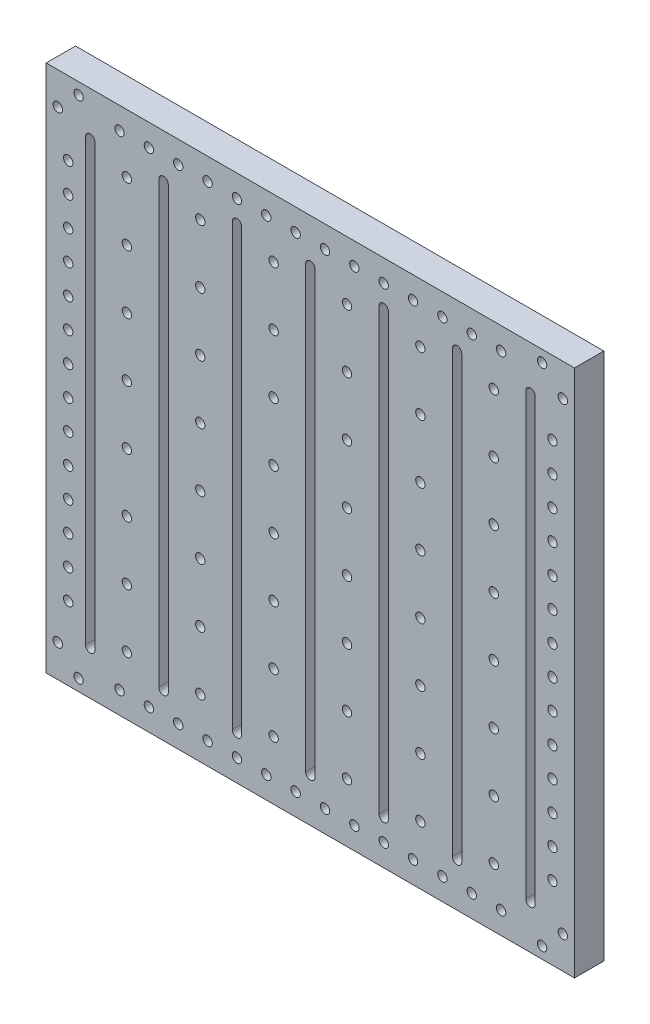
from build123d import *

# Parameters (mm, degrees)
SKETCH1_W             = 180
SKETCH1_H             = 180
SKETCH1_R             = 1.6
BOSS_EXTRUDE1_DEPTH   = 10
CRVPATTERN1_OUTLINE_R = 1.6
CRVPATTERN1_DEPTH     = 10


# Read off the part's stored shape, not the designer's step: CrvPattern1
with BuildPart() as part:
    # Sketch1 → Boss-Extrude1 (new body)
    with BuildSketch(Plane.XY):
        Rectangle(SKETCH1_W, SKETCH1_H)
        with Locations((-78.964466094, 86.035533906)):
            Circle(SKETCH1_R, mode=Mode.SUBTRACT)
        with Locations((-86.035533906, 78.964466094)):
            Circle(SKETCH1_R, mode=Mode.SUBTRACT)
        with Locations((78.964466094, 86.035533906)):
            Circle(SKETCH1_R, mode=Mode.SUBTRACT)
        with Locations((86.035533906, 78.964466094)):
            Circle(SKETCH1_R, mode=Mode.SUBTRACT)
        with Locations((86.035533906, -78.964466094)):
            Circle(SKETCH1_R, mode=Mode.SUBTRACT)
        with Locations((78.964466094, -86.035533906)):
            Circle(SKETCH1_R, mode=Mode.SUBTRACT)
        with Locations((-78.964466094, -86.035533906)):
            Circle(SKETCH1_R, mode=Mode.SUBTRACT)
        with Locations((-86.035533906, -78.964466094)):
            Circle(SKETCH1_R, mode=Mode.SUBTRACT)
        with Locations((-5, 82.5)):
            Circle(SKETCH1_R, mode=Mode.SUBTRACT)
        with Locations((5, 82.5)):
            Circle(SKETCH1_R, mode=Mode.SUBTRACT)
        with Locations((-15, 82.5)):
            Circle(SKETCH1_R, mode=Mode.SUBTRACT)
        with Locations((-25, 82.5)):
            Circle(SKETCH1_R, mode=Mode.SUBTRACT)
        with Locations((-35, 82.5)):
            Circle(SKETCH1_R, mode=Mode.SUBTRACT)
        with Locations((-45, 82.5)):
            Circle(SKETCH1_R, mode=Mode.SUBTRACT)
        with Locations((-55, 82.5)):
            Circle(SKETCH1_R, mode=Mode.SUBTRACT)
        with Locations((-65, 82.5)):
            Circle(SKETCH1_R, mode=Mode.SUBTRACT)
        with Locations((15, 82.5)):
            Circle(SKETCH1_R, mode=Mode.SUBTRACT)
        with Locations((25, 82.5)):
            Circle(SKETCH1_R, mode=Mode.SUBTRACT)
        with Locations((35, 82.5)):
            Circle(SKETCH1_R, mode=Mode.SUBTRACT)
        with Locations((45, 82.5)):
            Circle(SKETCH1_R, mode=Mode.SUBTRACT)
        with Locations((55, 82.5)):
            Circle(SKETCH1_R, mode=Mode.SUBTRACT)
        with Locations((65, 82.5)):
            Circle(SKETCH1_R, mode=Mode.SUBTRACT)
        with Locations((82.5, 65)):
            Circle(SKETCH1_R, mode=Mode.SUBTRACT)
        with Locations((82.5, 55)):
            Circle(SKETCH1_R, mode=Mode.SUBTRACT)
        with Locations((82.5, 45)):
            Circle(SKETCH1_R, mode=Mode.SUBTRACT)
        with Locations((82.5, 35)):
            Circle(SKETCH1_R, mode=Mode.SUBTRACT)
        with Locations((82.5, 25)):
            Circle(SKETCH1_R, mode=Mode.SUBTRACT)
        with Locations((82.5, 15)):
            Circle(SKETCH1_R, mode=Mode.SUBTRACT)
        with Locations((82.5, 5)):
            Circle(SKETCH1_R, mode=Mode.SUBTRACT)
        with Locations((82.5, -5)):
            Circle(SKETCH1_R, mode=Mode.SUBTRACT)
        with Locations((82.5, -15)):
            Circle(SKETCH1_R, mode=Mode.SUBTRACT)
        with Locations((82.5, -25)):
            Circle(SKETCH1_R, mode=Mode.SUBTRACT)
        with Locations((82.5, -35)):
            Circle(SKETCH1_R, mode=Mode.SUBTRACT)
        with Locations((82.5, -45)):
            Circle(SKETCH1_R, mode=Mode.SUBTRACT)
        with Locations((82.5, -55)):
            Circle(SKETCH1_R, mode=Mode.SUBTRACT)
        with Locations((82.5, -65)):
            Circle(SKETCH1_R, mode=Mode.SUBTRACT)
        with Locations((65, -82.5)):
            Circle(SKETCH1_R, mode=Mode.SUBTRACT)
        with Locations((55, -82.5)):
            Circle(SKETCH1_R, mode=Mode.SUBTRACT)
        with Locations((45, -82.5)):
            Circle(SKETCH1_R, mode=Mode.SUBTRACT)
        with Locations((35, -82.5)):
            Circle(SKETCH1_R, mode=Mode.SUBTRACT)
        with Locations((25, -82.5)):
            Circle(SKETCH1_R, mode=Mode.SUBTRACT)
        with Locations((15, -82.5)):
            Circle(SKETCH1_R, mode=Mode.SUBTRACT)
        with Locations((5, -82.5)):
            Circle(SKETCH1_R, mode=Mode.SUBTRACT)
        with Locations((-5, -82.5)):
            Circle(SKETCH1_R, mode=Mode.SUBTRACT)
        with Locations((-15, -82.5)):
            Circle(SKETCH1_R, mode=Mode.SUBTRACT)
        with Locations((-25, -82.5)):
            Circle(SKETCH1_R, mode=Mode.SUBTRACT)
        with Locations((-35, -82.5)):
            Circle(SKETCH1_R, mode=Mode.SUBTRACT)
        with Locations((-45, -82.5)):
            Circle(SKETCH1_R, mode=Mode.SUBTRACT)
        with Locations((-55, -82.5)):
            Circle(SKETCH1_R, mode=Mode.SUBTRACT)
        with Locations((-65, -82.5)):
            Circle(SKETCH1_R, mode=Mode.SUBTRACT)
        with Locations((-82.5, -65)):
            Circle(SKETCH1_R, mode=Mode.SUBTRACT)
        with Locations((-82.5, -55)):
            Circle(SKETCH1_R, mode=Mode.SUBTRACT)
        with Locations((-82.5, -45)):
            Circle(SKETCH1_R, mode=Mode.SUBTRACT)
        with Locations((-82.5, -35)):
            Circle(SKETCH1_R, mode=Mode.SUBTRACT)
        with Locations((-82.5, -25)):
            Circle(SKETCH1_R, mode=Mode.SUBTRACT)
        with Locations((-82.5, -15)):
            Circle(SKETCH1_R, mode=Mode.SUBTRACT)
        with Locations((-82.5, -5)):
            Circle(SKETCH1_R, mode=Mode.SUBTRACT)
        with Locations((-82.5, 5)):
            Circle(SKETCH1_R, mode=Mode.SUBTRACT)
        with Locations((-82.5, 15)):
            Circle(SKETCH1_R, mode=Mode.SUBTRACT)
        with Locations((-82.5, 25)):
            Circle(SKETCH1_R, mode=Mode.SUBTRACT)
        with Locations((-82.5, 35)):
            Circle(SKETCH1_R, mode=Mode.SUBTRACT)
        with Locations((-82.5, 45)):
            Circle(SKETCH1_R, mode=Mode.SUBTRACT)
        with Locations((-82.5, 55)):
            Circle(SKETCH1_R, mode=Mode.SUBTRACT)
        with Locations((-82.5, 65)):
            Circle(SKETCH1_R, mode=Mode.SUBTRACT)
        with Locations((-62.5, 70)):
            Circle(SKETCH1_R, mode=Mode.SUBTRACT)
        with Locations((-37.5, 70)):
            Circle(SKETCH1_R, mode=Mode.SUBTRACT)
        with Locations((-12.5, 70)):
            Circle(SKETCH1_R, mode=Mode.SUBTRACT)
        with Locations((12.5, 70)):
            Circle(SKETCH1_R, mode=Mode.SUBTRACT)
        with Locations((37.5, 70)):
            Circle(SKETCH1_R, mode=Mode.SUBTRACT)
        with Locations((62.5, 70)):
            Circle(SKETCH1_R, mode=Mode.SUBTRACT)
        with BuildLine():
            Line((-1.6, 75), (-1.6, -75))
            ThreePointArc((-1.6, -75), (0, -76.6), (1.6, -75))
            Line((1.6, -75), (1.6, 75))
            ThreePointArc((1.6, 75), (0, 76.6), (-1.6, 75))
        make_face(mode=Mode.SUBTRACT)
        with BuildLine():
            Line((23.4, 75), (23.4, -75))
            ThreePointArc((23.4, -75), (25, -76.6), (26.6, -75))
            Line((26.6, -75), (26.6, 75))
            ThreePointArc((26.6, 75), (25, 76.6), (23.4, 75))
        make_face(mode=Mode.SUBTRACT)
        with BuildLine():
            Line((48.4, 75), (48.4, -75))
            ThreePointArc((48.4, -75), (50, -76.6), (51.6, -75))
            Line((51.6, -75), (51.6, 75))
            ThreePointArc((51.6, 75), (50, 76.6), (48.4, 75))
        make_face(mode=Mode.SUBTRACT)
        with BuildLine():
            Line((73.4, 75), (73.4, -75))
            ThreePointArc((73.4, -75), (75, -76.6), (76.6, -75))
            Line((76.6, -75), (76.6, 75))
            ThreePointArc((76.6, 75), (75, 76.6), (73.4, 75))
        make_face(mode=Mode.SUBTRACT)
        with BuildLine():
            Line((-26.6, 75), (-26.6, -75))
            ThreePointArc((-26.6, -75), (-25, -76.6), (-23.4, -75))
            Line((-23.4, -75), (-23.4, 75))
            ThreePointArc((-23.4, 75), (-25, 76.6), (-26.6, 75))
        make_face(mode=Mode.SUBTRACT)
        with BuildLine():
            Line((-51.6, 75), (-51.6, -75))
            ThreePointArc((-51.6, -75), (-50, -76.6), (-48.4, -75))
            Line((-48.4, -75), (-48.4, 75))
            ThreePointArc((-48.4, 75), (-50, 76.6), (-51.6, 75))
        make_face(mode=Mode.SUBTRACT)
        with BuildLine():
            Line((-76.6, 75), (-76.6, -75))
            ThreePointArc((-76.6, -75), (-75, -76.6), (-73.4, -75))
            Line((-73.4, -75), (-73.4, 75))
            ThreePointArc((-73.4, 75), (-75, 76.6), (-76.6, 75))
        make_face(mode=Mode.SUBTRACT)
    extrude(amount=BOSS_EXTRUDE1_DEPTH)

    # CrvPattern1 outline → CrvPattern1 (cut)
    with BuildSketch(Plane.XY):
        with Locations((62.5, -70)):
            Circle(CRVPATTERN1_OUTLINE_R)
        with Locations((37.5, -70)):
            Circle(CRVPATTERN1_OUTLINE_R)
        with Locations((12.5, -70)):
            Circle(CRVPATTERN1_OUTLINE_R)
        with Locations((-12.5, -70)):
            Circle(CRVPATTERN1_OUTLINE_R)
        with Locations((-37.5, -70)):
            Circle(CRVPATTERN1_OUTLINE_R)
        with Locations((-62.5, -70)):
            Circle(CRVPATTERN1_OUTLINE_R)
        with Locations((62.5, -50)):
            Circle(CRVPATTERN1_OUTLINE_R)
        with Locations((37.5, -50)):
            Circle(CRVPATTERN1_OUTLINE_R)
        with Locations((12.5, -50)):
            Circle(CRVPATTERN1_OUTLINE_R)
        with Locations((-12.5, -50)):
            Circle(CRVPATTERN1_OUTLINE_R)
        with Locations((-37.5, -50)):
            Circle(CRVPATTERN1_OUTLINE_R)
        with Locations((-62.5, -50)):
            Circle(CRVPATTERN1_OUTLINE_R)
        with Locations((62.5, -30)):
            Circle(CRVPATTERN1_OUTLINE_R)
        with Locations((37.5, -30)):
            Circle(CRVPATTERN1_OUTLINE_R)
        with Locations((12.5, -30)):
            Circle(CRVPATTERN1_OUTLINE_R)
        with Locations((-12.5, -30)):
            Circle(CRVPATTERN1_OUTLINE_R)
        with Locations((-37.5, -30)):
            Circle(CRVPATTERN1_OUTLINE_R)
        with Locations((-62.5, -30)):
            Circle(CRVPATTERN1_OUTLINE_R)
        with Locations((62.5, -10)):
            Circle(CRVPATTERN1_OUTLINE_R)
        with Locations((37.5, -10)):
            Circle(CRVPATTERN1_OUTLINE_R)
        with Locations((12.5, -10)):
            Circle(CRVPATTERN1_OUTLINE_R)
        with Locations((-12.5, -10)):
            Circle(CRVPATTERN1_OUTLINE_R)
        with Locations((-37.5, -10)):
            Circle(CRVPATTERN1_OUTLINE_R)
        with Locations((-62.5, -10)):
            Circle(CRVPATTERN1_OUTLINE_R)
        with Locations((62.5, 10)):
            Circle(CRVPATTERN1_OUTLINE_R)
        with Locations((37.5, 10)):
            Circle(CRVPATTERN1_OUTLINE_R)
        with Locations((12.5, 10)):
            Circle(CRVPATTERN1_OUTLINE_R)
        with Locations((-12.5, 10)):
            Circle(CRVPATTERN1_OUTLINE_R)
        with Locations((-37.5, 10)):
            Circle(CRVPATTERN1_OUTLINE_R)
        with Locations((-62.5, 10)):
            Circle(CRVPATTERN1_OUTLINE_R)
        with Locations((62.5, 30)):
            Circle(CRVPATTERN1_OUTLINE_R)
        with Locations((37.5, 30)):
            Circle(CRVPATTERN1_OUTLINE_R)
        with Locations((12.5, 30)):
            Circle(CRVPATTERN1_OUTLINE_R)
        with Locations((-12.5, 30)):
            Circle(CRVPATTERN1_OUTLINE_R)
        with Locations((-37.5, 30)):
            Circle(CRVPATTERN1_OUTLINE_R)
        with Locations((-62.5, 30)):
            Circle(CRVPATTERN1_OUTLINE_R)
        with Locations((62.5, 50)):
            Circle(CRVPATTERN1_OUTLINE_R)
        with Locations((37.5, 50)):
            Circle(CRVPATTERN1_OUTLINE_R)
        with Locations((12.5, 50)):
            Circle(CRVPATTERN1_OUTLINE_R)
        with Locations((-12.5, 50)):
            Circle(CRVPATTERN1_OUTLINE_R)
        with Locations((-37.5, 50)):
            Circle(CRVPATTERN1_OUTLINE_R)
        with Locations((-62.5, 50)):
            Circle(CRVPATTERN1_OUTLINE_R)
    extrude(amount=CRVPATTERN1_DEPTH, mode=Mode.SUBTRACT)


solid = part.part
